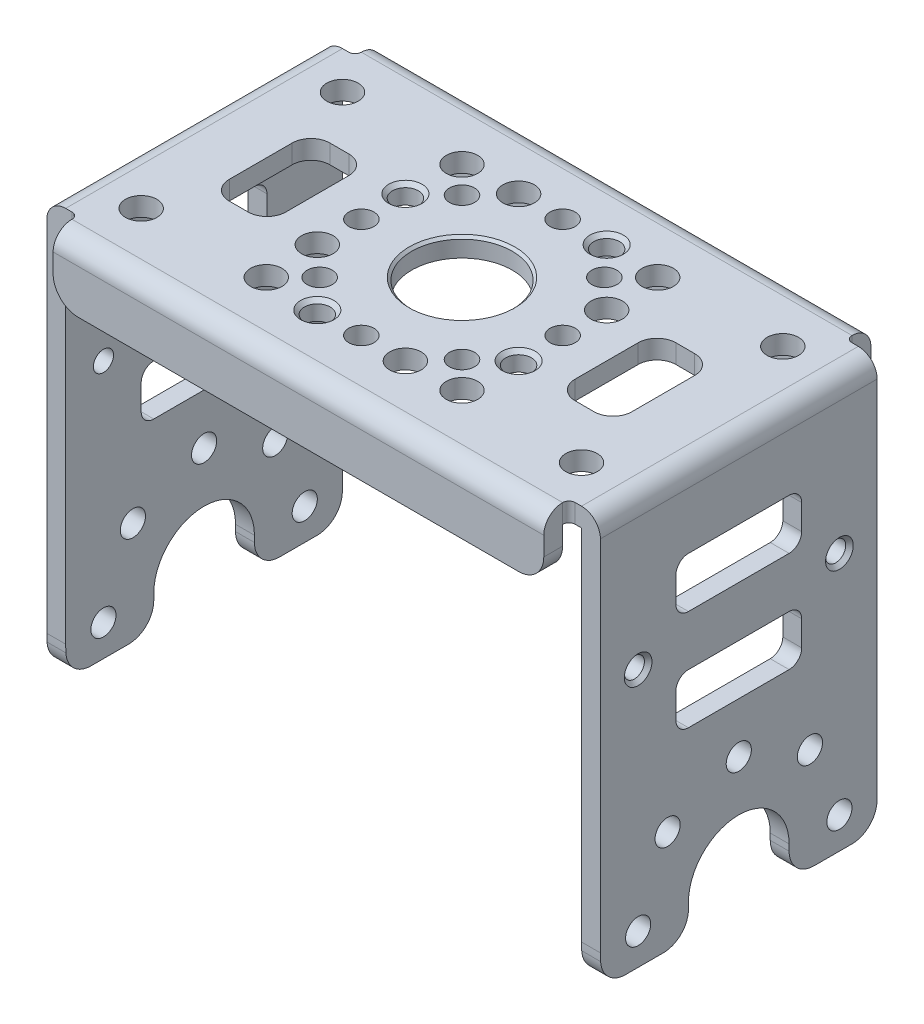
from build123d import *

# Parameters (mm, degrees)
CUT_EXTRUDE1_START               = -42.5
CUT_EXTRUDE1_OUTLINE_W           = 22
CUT_EXTRUDE1_OUTLINE_H           = 1.5
CUT_EXTRUDE1_DEPTH               = 44
CUT_EXTRUDE1_2_DEPTH             = 1.5
CUT_EXTRUDE1_3_DEPTH             = 1.5
SKETCH2_W                        = 39
SKETCH2_H                        = 1.5
BOSS_EXTRUDE1_DEPTH              = 2
SKETCH3_W                        = 39
SKETCH3_H                        = 1.5
BOSS_EXTRUDE2_DEPTH              = 3.5
SKETCH4_W                        = 39
SKETCH4_H                        = 1.5
BOSS_EXTRUDE3_DEPTH              = 2
SKETCH5_W                        = 39
SKETCH5_H                        = 1.5
BOSS_EXTRUDE4_DEPTH              = 3.5
CUT_EXTRUDE2_DEPTH               = 54.621357685
CUT_EXTRUDE3_DEPTH               = 54.621357685
SKETCH8_W                        = 4.5
SKETCH8_H                        = 8
CUT_EXTRUDE4_DEPTH               = 42.343076809
CUT_EXTRUDE5_REACH               = 55.621
SKETCH9_W                        = 10
SKETCH9_H                        = 4
CUT_EXTRUDE6_REACH               = 55.621
SKETCH10_W                       = 10
SKETCH10_H                       = 4
CUT_EXTRUDE7_REACH               = 55.621
SKETCH11_W                       = 10
SKETCH11_H                       = 4
CUT_EXTRUDE8_REACH               = 55.621
SKETCH12_W                       = 10
SKETCH12_H                       = 4
SKETCH13_W                       = 4.5
SKETCH13_H                       = 8
CUT_EXTRUDE9_DEPTH               = 41.174618853
F_2_5_2_5_DIAMETER_HOLE1_D       = 2.5
F_2_05_2_05_DIAMETER_HOLE1_D     = 2.05
F_2_05_2_05_DIAMETER_HOLE1_DEPTH = 32.5
F_2_0_2_DIAMETER_HOLE1_D         = 2
F_8_0_8_DIAMETER_HOLE1_D         = 8
F_8_0_8_DIAMETER_HOLE1_DEPTH     = 32.5
F_2_0_2_DIAMETER_HOLE2_D         = 2
F_2_0_2_DIAMETER_HOLE2_DEPTH     = 1.5
F_1_6_1_6_DIAMETER_HOLE1_D       = 1.6
F_1_6_1_6_DIAMETER_HOLE1_DEPTH   = 1.5
F_2_0_2_DIAMETER_HOLE3_D         = 2
F_1_6_1_6_DIAMETER_HOLE2_D       = 1.6
F_1_6_1_6_DIAMETER_HOLE2_DEPTH   = 44
CHAMFER1_SIZE                    = 0.3
CHAMFER2_SIZE                    = 0.2
FILLET1_R                        = 0.5
FILLET2_R                        = 1
FILLET3_R                        = 1.5
FILLET4_R                        = 2


with BuildPart() as part:
    # Cut-Extrude1: read off the stored shape, not the designer's step
    # Cut-Extrude1 outline → Cut-Extrude1 (new body)
    with BuildSketch(Plane(origin=(20.5, 0, 0), x_dir=(0, 0, -1), z_dir=(1, 0, 0)).offset(CUT_EXTRUDE1_START)):
        with Locations((0, 29.25)):
            Rectangle(CUT_EXTRUDE1_OUTLINE_W, CUT_EXTRUDE1_OUTLINE_H)
    extrude(amount=CUT_EXTRUDE1_DEPTH)

    # Cut-Extrude1 2 outline → Cut-Extrude1 2 (add)
    with BuildSketch(Plane(origin=(20.5, 0, 0), x_dir=(0, 0, -1), z_dir=(1, 0, 0)).offset(CUT_EXTRUDE1_START)):
        with BuildLine():
            Line((-11, 28.5), (-11, 0))
            ThreePointArc((-11, 0), (-10.927798705, -1.258258902), (-10.712142643, -2.5))
            Line((-10.712142643, -2.5), (10.712142643, -2.5))
            ThreePointArc((10.712142643, -2.5), (10.927798705, -1.258258902), (11, 0))
            Line((11, 0), (11, 28.5))
            Line((11, 28.5), (-11, 28.5))
        make_face()
    extrude(amount=CUT_EXTRUDE1_2_DEPTH)

    # Cut-Extrude1 3 outline → Cut-Extrude1 3 (add)
    with BuildSketch(Plane(origin=(20.5, 0, 0), x_dir=(0, 0, -1), z_dir=(1, 0, 0))):
        with BuildLine():
            Line((-11, 28.5), (-11, 0))
            ThreePointArc((-11, 0), (-10.927798705, -1.258258902), (-10.712142643, -2.5))
            Line((-10.712142643, -2.5), (10.712142643, -2.5))
            ThreePointArc((10.712142643, -2.5), (10.927798705, -1.258258902), (11, 0))
            Line((11, 0), (11, 28.5))
            Line((11, 28.5), (-11, 28.5))
        make_face()
    extrude(amount=CUT_EXTRUDE1_3_DEPTH)

    # Sketch2 → Boss-Extrude1 (add)
    with BuildSketch(Plane.XY.offset(11)):
        with Locations((0, 29.25)):
            Rectangle(SKETCH2_W, SKETCH2_H)
    extrude(amount=BOSS_EXTRUDE1_DEPTH)

    # Sketch3 → Boss-Extrude2 (add)
    with BuildSketch(Plane.XZ.offset(-28.5)):
        with Locations((0, 12.25)):
            Rectangle(SKETCH3_W, SKETCH3_H)
    extrude(amount=BOSS_EXTRUDE2_DEPTH)

    # Sketch4 → Boss-Extrude3 (add)
    with BuildSketch(Plane(origin=(0, 0, -11), x_dir=(-1, 0, 0), z_dir=(0, 0, -1))):
        with Locations((0, 29.25)):
            Rectangle(SKETCH4_W, SKETCH4_H)
    extrude(amount=BOSS_EXTRUDE3_DEPTH)

    # Sketch5 → Boss-Extrude4 (add)
    with BuildSketch(Plane.XZ.offset(-28.5)):
        with Locations((0, -12.25)):
            Rectangle(SKETCH5_W, SKETCH5_H)
    extrude(amount=BOSS_EXTRUDE4_DEPTH)

    # Sketch6 → Cut-Extrude2 (cut, through all)
    with BuildSketch(Plane.ZY.offset(-20.5)):
        with BuildLine():
            Line((-4, -2.5), (4, -2.5))
            Line((4, -2.5), (4, 0))
            ThreePointArc((4, 0), (0, 4), (-4, 0))
            Line((-4, 0), (-4, -2.5))
        make_face()
    extrude(amount=-CUT_EXTRUDE2_DEPTH, mode=Mode.SUBTRACT)

    # Sketch7 → Cut-Extrude3 (cut, through all)
    with BuildSketch(Plane(origin=(-20.5, 0, 0), x_dir=(0, 0, -1), z_dir=(1, 0, 0))):
        with BuildLine():
            Line((-4, -2.5), (4, -2.5))
            Line((4, -2.5), (4, 0))
            ThreePointArc((4, 0), (0, 4), (-4, 0))
            Line((-4, 0), (-4, -2.5))
        make_face()
    extrude(amount=-CUT_EXTRUDE3_DEPTH, mode=Mode.SUBTRACT)

    # Sketch8 → Cut-Extrude4 (cut, through all)
    with BuildSketch(Plane(origin=(0, 30, 0), x_dir=(-1, 0, 0), z_dir=(0, 1, 0))):
        with Locations((-13.75, 0)):
            Rectangle(SKETCH8_W, SKETCH8_H)
    extrude(amount=-CUT_EXTRUDE4_DEPTH, mode=Mode.SUBTRACT)

    # Sketch9 → Cut-Extrude5 (cut, up to next)
    with BuildSketch(Plane.ZY.offset(-20.5), mode=Mode.PRIVATE) as cut_extrude5_sk1:
        with Locations((0, 22)):
            Rectangle(SKETCH9_W, SKETCH9_H)
    cut_extrude5_tool1 = extrude(cut_extrude5_sk1.sketch, amount=-CUT_EXTRUDE5_REACH, mode=Mode.PRIVATE) & part.part
    add(cut_extrude5_tool1.solids().sort_by_distance((20.5, 22, 0))[0], mode=Mode.SUBTRACT)

    # Sketch10 → Cut-Extrude6 (cut, up to next)
    with BuildSketch(Plane.ZY.offset(-20.5), mode=Mode.PRIVATE) as cut_extrude6_sk1:
        with Locations((0, 14)):
            Rectangle(SKETCH10_W, SKETCH10_H)
    cut_extrude6_tool1 = extrude(cut_extrude6_sk1.sketch, amount=-CUT_EXTRUDE6_REACH, mode=Mode.PRIVATE) & part.part
    add(cut_extrude6_tool1.solids().sort_by_distance((20.5, 14, 0))[0], mode=Mode.SUBTRACT)

    # Sketch11 → Cut-Extrude7 (cut, up to next)
    with BuildSketch(Plane(origin=(-20.5, 0, 0), x_dir=(0, 0, -1), z_dir=(1, 0, 0)), mode=Mode.PRIVATE) as cut_extrude7_sk1:
        with Locations((0, 22)):
            Rectangle(SKETCH11_W, SKETCH11_H)
    cut_extrude7_tool1 = extrude(cut_extrude7_sk1.sketch, amount=-CUT_EXTRUDE7_REACH, mode=Mode.PRIVATE) & part.part
    add(cut_extrude7_tool1.solids().sort_by_distance((-20.5, 22, 0))[0], mode=Mode.SUBTRACT)

    # Sketch12 → Cut-Extrude8 (cut, up to next)
    with BuildSketch(Plane(origin=(-20.5, 0, 0), x_dir=(0, 0, -1), z_dir=(1, 0, 0)), mode=Mode.PRIVATE) as cut_extrude8_sk1:
        with Locations((0, 14)):
            Rectangle(SKETCH12_W, SKETCH12_H)
    cut_extrude8_tool1 = extrude(cut_extrude8_sk1.sketch, amount=-CUT_EXTRUDE8_REACH, mode=Mode.PRIVATE) & part.part
    add(cut_extrude8_tool1.solids().sort_by_distance((-20.5, 14, 0))[0], mode=Mode.SUBTRACT)

    # Sketch13 → Cut-Extrude9 (cut, through all)
    with BuildSketch(Plane.XZ.offset(-28.5)):
        with Locations((-13.75, 0)):
            Rectangle(SKETCH13_W, SKETCH13_H)
    extrude(amount=-CUT_EXTRUDE9_DEPTH, mode=Mode.SUBTRACT)

    # Ø2.5 (2.5) Diameter Hole1 (through all)
    with Locations(Plane(origin=(0, 28.5, 0), x_dir=(-1, 0, 0), z_dir=(0, -1, 0))):
        with Locations((-8, 3.5), (3.5, 8), (8, -3.5), (-3.5, -8), (-17.5, 8), (-17.5, -8), (17.5, 8), (17.5, -8), (-7.778174593, 7.778174593), (-7.778174593, -7.778174593), (7.778174593, -7.778174593), (7.778174593, 7.778174593)):
            Hole(F_2_5_2_5_DIAMETER_HOLE1_D / 2)

    # Ø2.05 (2.05) Diameter Hole1
    with Locations(Plane(origin=(0, 30, 0), x_dir=(1, 0, 0), z_dir=(0, 1, 0))):
        with Locations((3.5, 8), (-8, 3.5), (-3.5, -8), (8, -3.5)):
            Hole(F_2_05_2_05_DIAMETER_HOLE1_D / 2, depth=F_2_05_2_05_DIAMETER_HOLE1_DEPTH)

    # Ø2.0 (2) Diameter Hole1 (through all)
    with Locations(Plane(origin=(0, 28.5, 0), x_dir=(-1, 0, 0), z_dir=(0, -1, 0))):
        with Locations((0, 8), (-5.656854249, 5.656854249), (-8, 0), (-5.656854249, -5.656854249), (0, -8), (5.656854249, -5.656854249), (8, 0), (5.656854249, 5.656854249)):
            Hole(F_2_0_2_DIAMETER_HOLE1_D / 2)

    # Ø8.0 (8) Diameter Hole1
    with Locations(Plane(origin=(0, 30, 0), x_dir=(1, 0, 0), z_dir=(0, 1, 0))):
        with Locations((0, 0)):
            Hole(F_8_0_8_DIAMETER_HOLE1_D / 2, depth=F_8_0_8_DIAMETER_HOLE1_DEPTH)

    # Ø2.0 (2) Diameter Hole2
    with Locations(Plane(origin=(-20.5, 0, 0), x_dir=(0, 0, -1), z_dir=(1, 0, 0))):
        with Locations((-8, 0), (-5.656854249, 5.656854249), (0, 8), (5.656854249, 5.656854249), (8, 0)):
            Hole(F_2_0_2_DIAMETER_HOLE2_D / 2, depth=F_2_0_2_DIAMETER_HOLE2_DEPTH)

    # Ø1.6 (1.6) Diameter Hole1
    with Locations(Plane(origin=(-20.5, 0, 0), x_dir=(0, 0, -1), z_dir=(1, 0, 0))):
        with Locations((8, 18), (-8, 18)):
            Hole(F_1_6_1_6_DIAMETER_HOLE1_D / 2, depth=F_1_6_1_6_DIAMETER_HOLE1_DEPTH)

    # Ø2.0 (2) Diameter Hole3 (through all)
    with Locations(Plane.ZY.offset(-20.5)):
        with Locations((8, 0), (5.656854249, 5.656854249), (0, 8), (-5.656854249, 5.656854249), (-8, 0)):
            Hole(F_2_0_2_DIAMETER_HOLE3_D / 2)

    # Ø1.6 (1.6) Diameter Hole2
    with Locations(Plane(origin=(22, 0, 0), x_dir=(0, 0, -1), z_dir=(1, 0, 0))):
        with Locations((8, 18), (-8, 18)):
            Hole(F_1_6_1_6_DIAMETER_HOLE2_D / 2, depth=F_1_6_1_6_DIAMETER_HOLE2_DEPTH)

    # Chamfer1
    chamfer1_edges = [part.edges().sort_by_distance(p)[0] for p in [
        (9.025, 30, 3.5),
        (-2.475, 30, 8),
        (-6.975, 30, -3.5),
        (4.525, 30, -8),
        (22, 18, 7.2),
        (22, 18, -8.8),
    ]]
    chamfer(chamfer1_edges, length=CHAMFER1_SIZE)

    # Chamfer2
    chamfer2_edges = [part.edges().sort_by_distance(p)[0] for p in [
        (4, 30, 0),
    ]]
    chamfer(chamfer2_edges, length=CHAMFER2_SIZE)

    # Fillet1
    fillet1_edges = [part.edges().sort_by_distance(p)[0] for p in [
        (19.5, 29.25, -11),
        (19.5, 29.25, 11),
        (-19.5, 29.25, -11),
        (-19.5, 29.25, 11),
    ]]
    fillet(fillet1_edges, radius=FILLET1_R)

    # Fillet2
    fillet2_edges = [part.edges().sort_by_distance(p)[0] for p in [
        (21.25, 20, 5),
        (21.25, 20, -5),
        (21.25, 24, -5),
        (21.25, 24, 5),
        (21.25, 12, 5),
        (21.25, 12, -5),
        (21.25, 16, -5),
        (21.25, 16, 5),
        (-21.25, 24, 5),
        (-21.25, 24, -5),
        (-21.25, 20, -5),
        (-21.25, 20, 5),
        (-21.25, 16, 5),
        (-21.25, 16, -5),
        (-21.25, 12, -5),
        (-21.25, 12, 5),
    ]]
    fillet(fillet2_edges, radius=FILLET2_R)

    # Fillet3
    fillet3_edges = [part.edges().sort_by_distance(p)[0] for p in [
        (-11.5, 29.25, -4),
        (16, 29.25, 4),
        (-16, 29.25, 4),
        (0, 30, -13),
        (16, 29.25, -4),
        (11.5, 29.25, 4),
        (-16, 29.25, -4),
        (22, 30, 0),
        (-11.5, 29.25, 4),
        (0, 30, 13),
        (-22, 30, 0),
        (11.5, 29.25, -4),
    ]]
    fillet(fillet3_edges, radius=FILLET3_R)

    # Fillet4
    fillet4_edges = [part.edges().sort_by_distance(p)[0] for p in [
        (-21.25, -2.5, -10.712142643),
        (21.25, -2.5, 10.712142643),
        (-19.5, 25, 12.25),
        (19.5, 25, 12.25),
        (19.5, 25, -12.25),
        (-19.5, 25, -12.25),
        (21.25, -2.5, -4),
        (21.25, -2.5, 4),
        (-21.25, -2.5, 4),
        (-21.25, -2.5, -4),
        (-21.25, -2.5, 10.712142643),
        (21.25, -2.5, -10.712142643),
    ]]
    fillet(fillet4_edges, radius=FILLET4_R)


solid = part.part
